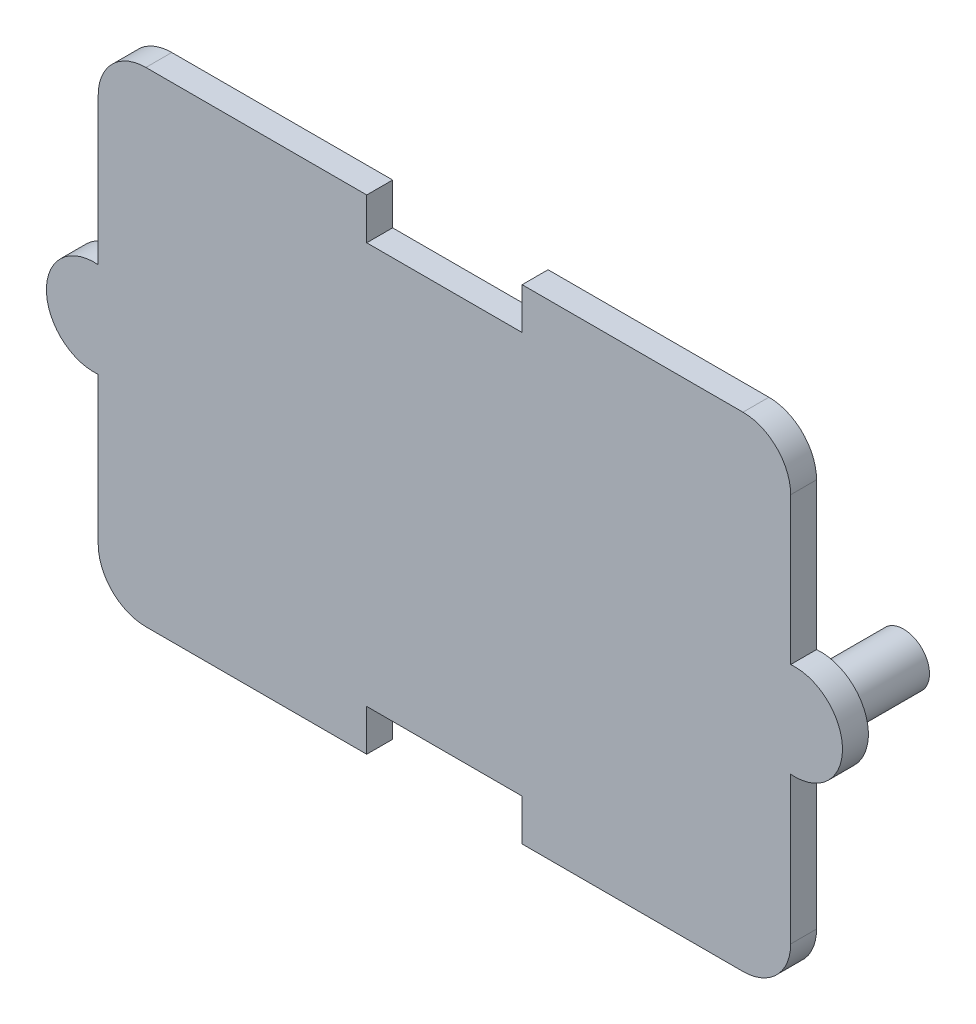
from build123d import *

# Parameters (mm, degrees)
BOSS_EXTRUDE1_DEPTH = 1.5875
SKETCH3_W           = 9.525
SKETCH3_H           = 2.54
CUT_EXTRUDE1_DEPTH  = 29.598819744
SKETCH4_R           = 1.5875
BOSS_EXTRUDE2_DEPTH = 5.08


with BuildPart() as part:
    # Sketch2 → Boss-Extrude1 (new body)
    with BuildSketch(Plane.XY):
        with BuildLine():
            Line((21.2185, 2.909935566), (21.2185, 11.9225))
            ThreePointArc((21.2185, 11.9225), (20.362958908, 13.987958908), (18.2975, 14.8435))
            Line((18.2975, 14.8435), (-18.2975, 14.8435))
            ThreePointArc((-18.2975, 14.8435), (-20.362958908, 13.987958908), (-21.2185, 11.9225))
            Line((-21.2185, 11.9225), (-21.2185, 2.909935566))
            ThreePointArc((-21.2185, 2.909935566), (-24.3935, 0), (-21.2185, -2.909935566))
            Line((-21.2185, -2.909935566), (-21.2185, -11.9225))
            ThreePointArc((-21.2185, -11.9225), (-20.362958908, -13.987958908), (-18.2975, -14.8435))
            Line((-18.2975, -14.8435), (18.2975, -14.8435))
            ThreePointArc((18.2975, -14.8435), (20.362958908, -13.987958908), (21.2185, -11.9225))
            Line((21.2185, -11.9225), (21.2185, -2.909935566))
            ThreePointArc((21.2185, -2.909935566), (24.3935, 0), (21.2185, 2.909935566))
        make_face()
    extrude(amount=BOSS_EXTRUDE1_DEPTH)

    # Sketch3 → Cut-Extrude1 (cut, through all)
    with BuildSketch(Plane.XY.offset(1.5875)):
        with Locations((0, -13.5735)):
            Rectangle(SKETCH3_W, SKETCH3_H)
        with Locations((0, 13.5735)):
            Rectangle(SKETCH3_W, SKETCH3_H)
    extrude(amount=-CUT_EXTRUDE1_DEPTH, mode=Mode.SUBTRACT)

    # Sketch4 → Boss-Extrude2 (add)
    with BuildSketch(Plane(origin=(0, 0, 0), x_dir=(-1, 0, 0), z_dir=(0, 0, -1))):
        with Locations((-21.4725, 0)):
            Circle(SKETCH4_R)
        with Locations((21.4725, 0)):
            Circle(SKETCH4_R)
    extrude(amount=BOSS_EXTRUDE2_DEPTH)


solid = part.part
